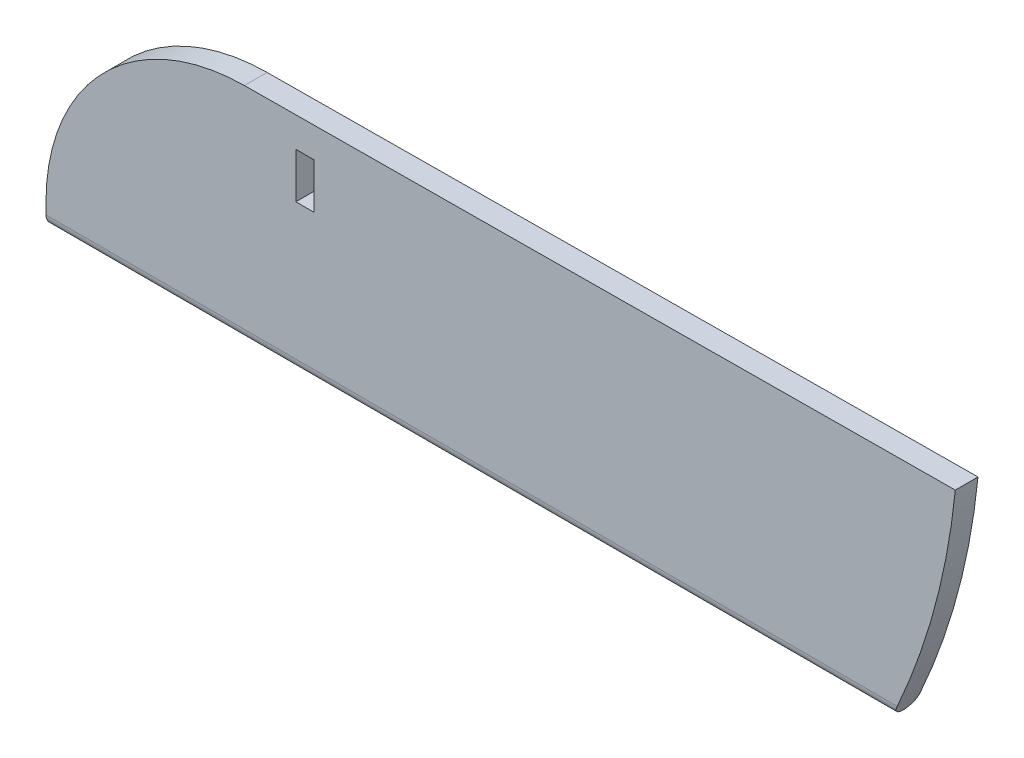
from build123d import *

# Parameters (mm, degrees)
BOSS_EXTRU_1_DEPTH      = 5
ESQUISSE3_W             = 10
ESQUISSE3_H             = 3
ENL_V_MAT_EXTRU_1_DEPTH = 231.967242256
ENL_V_MAT_EXTRU_2_DEPTH = 231.967242256
ESQUISSE2_W             = 203.424903091
ESQUISSE2_H             = 131.549645995
ENL_V_MAT_EXTRU_3_DEPTH = 231.967242256
CONG_1_R                = 2.5
ESQUISSE5_W             = 4
ESQUISSE5_H             = 10
ENL_V_MAT_EXTRU_4_DEPTH = 206.267190359


with BuildPart() as part:
    # Esquisse1 → Boss.-Extru.1 (new body)
    with BuildSketch(Plane.XY):
        with BuildLine():
            Line((0, 0), (0, -25))
            Line((0, -25), (37.5, -25))
            Line((37.5, -25), (37.5, -95.5))
            Line((37.5, -95.5), (32.5, -95.5))
            Line((32.5, -95.5), (36.487358688, -115.098494092))
            Line((36.487358688, -115.098494092), (88.487358688, -115.098494092))
            Line((88.487358688, -115.098494092), (159.198036807, -44.387815974))
            ThreePointArc((159.198036807, -44.387815974), (187.146342861, -3.044299659), (200.182925478, 45.126663235))
            Line((200.182925478, 45.126663235), (43.682925478, 43.998857528))
            ThreePointArc((43.682925478, 43.998857528), (12.775400091, 31.000392909), (0, 0))
        make_face()
    extrude(amount=BOSS_EXTRU_1_DEPTH)

    # Esquisse3 → Enlèv. mat.-Extru.1 (cut, through all)
    with BuildSketch(Plane.XY.offset(5)):
        with Locations((5, -23.5)):
            Rectangle(ESQUISSE3_W, ESQUISSE3_H)
    extrude(amount=-ENL_V_MAT_EXTRU_1_DEPTH, mode=Mode.SUBTRACT)

    # Esquisse4 → Enlèv. mat.-Extru.2 (cut, through all)
    with BuildSketch(Plane.XY.offset(5)):
        Polygon((88.487358688, -105.098494092), (78.487358688, -105.098494092), (78.487358688, -111.098494092), (68.487358688, -115.098494092), (78.487358688, -115.098494092), (88.487358688, -115.098494092), (98.487358688, -105.098494092), align=None)
    extrude(amount=-ENL_V_MAT_EXTRU_2_DEPTH, mode=Mode.SUBTRACT)

    # Esquisse2 → Enlèv. mat.-Extru.3 (cut, through all)
    with BuildSketch(Plane.XY.offset(5)):
        with Locations((101.712451546, -70.774822998)):
            Rectangle(ESQUISSE2_W, ESQUISSE2_H)
    extrude(amount=-ENL_V_MAT_EXTRU_3_DEPTH, mode=Mode.SUBTRACT)

    # Congé1
    cong_1_edges = [part.edges().sort_by_distance(p)[0] for p in [
        (93.117022594, -5, 0),
        (93.117022594, -5, 5),
    ]]
    fillet(cong_1_edges, radius=CONG_1_R - 0.0001)  # a hair under: the kernel refuses the full size

    # Esquisse5 → Enlèv. mat.-Extru.4 (cut, through all)
    with BuildSketch(Plane.XY.offset(5)):
        with Locations((57, 32.5)):
            Rectangle(ESQUISSE5_W, ESQUISSE5_H)
    extrude(amount=-ENL_V_MAT_EXTRU_4_DEPTH, mode=Mode.SUBTRACT)


solid = part.part
